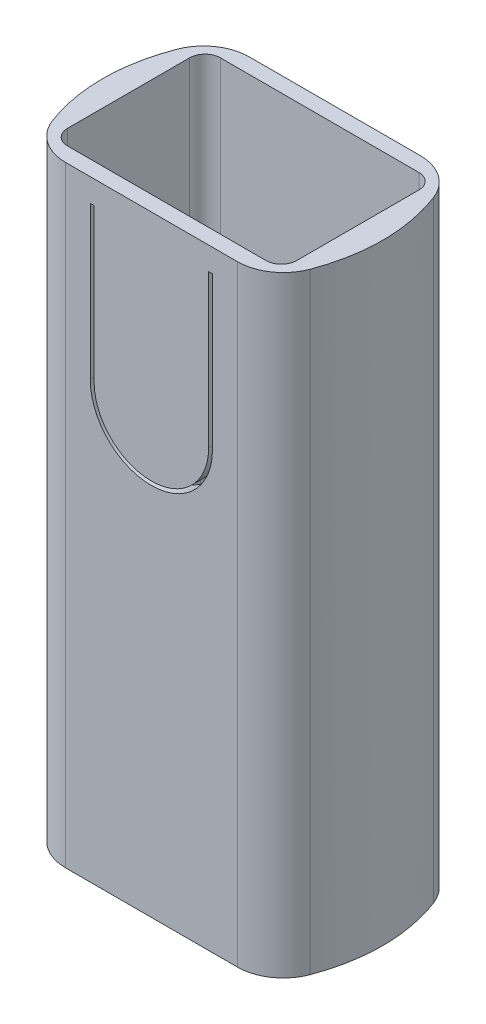
from build123d import *

# Parameters (mm, degrees)
BOSS_EXTRUDE4_DEPTH = 80
BOSS_EXTRUDE5_DEPTH = 57
CUT_EXTRUDE1_DEPTH  = 3


with BuildPart() as part:
    # Sketch8 → Boss-Extrude4 (new body)
    with BuildSketch(Plane(origin=(0, 58, 0), x_dir=(1, 0, 0), z_dir=(0, 1, 0))):
        with BuildLine():
            Line((-11.242998329, -12), (11.242998329, -12))
            ThreePointArc((11.242998329, -12), (14.65898127, -10.932652486), (16.859617244, -8.110353516))
            add(Edge.make_bspline(
                [(16.859617244, -8.110353516), (17.850691528, -5.47265015), (18.834301101, 0.028433299), (17.819526561, 5.426475811), (16.811684873, 8.109721667)],
                knots=[0.167422492, 0.167422492, 0.167422492, 0.167422492, 0.502499344, 0.837905074, 0.837905074, 0.837905074, 0.837905074], degree=3))
            ThreePointArc((16.811684873, 8.109721667), (14.611088973, 10.932460339), (11.194828591, 12))
            Line((11.194828591, 12), (-11.194828591, 12))
            ThreePointArc((-11.194828591, 12), (-14.611088973, 10.932460339), (-16.811684873, 8.109721667))
            add(Edge.make_bspline(
                [(-16.859617244, -8.110353516), (-17.850691528, -5.47265015), (-18.834301101, 0.028433299), (-17.819526561, 5.426475811), (-16.811684873, 8.109721667)],
                knots=[0.167422492, 0.167422492, 0.167422492, 0.167422492, 0.502499344, 0.837905074, 0.837905074, 0.837905074, 0.837905074], degree=3))
            ThreePointArc((-16.859617244, -8.110353516), (-14.65898127, -10.932652486), (-11.242998329, -12))
        make_face()
        with BuildLine():
            Line((-13, -10), (13, -10))
            ThreePointArc((13, -10), (14.414213562, -9.414213562), (15, -8))
            Line((15, -8), (15, 8))
            ThreePointArc((15, 8), (14.414213562, 9.414213562), (13, 10))
            Line((13, 10), (-13, 10))
            ThreePointArc((-13, 10), (-14.414213562, 9.414213562), (-15, 8))
            Line((-15, 8), (-15, -8))
            ThreePointArc((-15, -8), (-14.414213562, -9.414213562), (-13, -10))
        make_face(mode=Mode.SUBTRACT)
    extrude(amount=BOSS_EXTRUDE4_DEPTH)

    # Sketch11 → Boss-Extrude5 (add)
    with BuildSketch(Plane(origin=(0, 58, 0), x_dir=(1, 0, 0), z_dir=(0, 1, 0))):
        with BuildLine():
            Line((13, 10), (15, 10))
            Line((15, 10), (15, 6.937911183))
            Line((15, 6.937911183), (13.5, 6.937911183))
            ThreePointArc((13.5, 6.937911183), (13.146446609, 7.084357793), (13, 7.437911183))
            Line((13, 7.437911183), (13, 10))
        make_face()
        with BuildLine():
            Line((-13, 7.437911183), (-13, 10))
            Line((-13, 10), (-15, 10))
            Line((-15, 10), (-15, 6.937911183))
            Line((-15, 6.937911183), (-13.5, 6.937911183))
            ThreePointArc((-13.5, 6.937911183), (-13.146446609, 7.084357793), (-13, 7.437911183))
        make_face()
    extrude(amount=BOSS_EXTRUDE5_DEPTH)

    # Sketch12 → Cut-Extrude1 (cut)
    with BuildSketch(Plane.XY.offset(12)):
        with BuildLine():
            Line((7.476357736, 134.986611492), (7.476357736, 114.986611492))
            ThreePointArc((7.476357736, 114.986611492), (-0.023642264, 107.486611492), (-7.523642264, 114.986611492))
            Line((-7.523642264, 114.986611492), (-7.523642264, 134.986611492))
            Line((-7.523642264, 134.986611492), (-8.023642264, 134.986611492))
            Line((-8.023642264, 134.986611492), (-8.023642264, 114.986611492))
            ThreePointArc((-8.023642264, 114.986611492), (-0.023642264, 106.986611492), (7.976357736, 114.986611492))
            Line((7.976357736, 114.986611492), (7.976357736, 134.986611492))
            Line((7.976357736, 134.986611492), (7.476357736, 134.986611492))
        make_face()
    extrude(amount=-CUT_EXTRUDE1_DEPTH, mode=Mode.SUBTRACT)


solid = part.part
